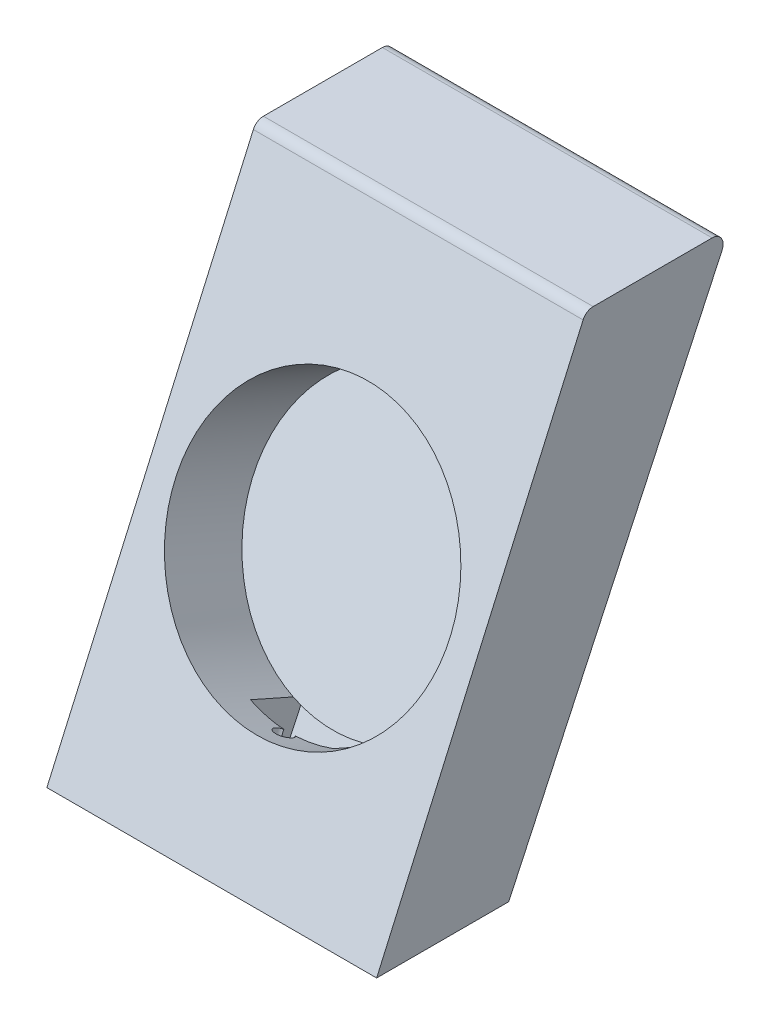
from build123d import *

# Parameters (mm, degrees)
BOSS_EXTRUDE1_DEPTH              = 76.2
FILLET1_R                        = 2.54
CUT_EXTRUDE1_REACH               = 166.479
CUT_EXTRUDE1_OFFSET_FROM_SURFACE = 9
SKETCH2_R                        = 31.75
CUT_EXTRUDE2_REACH               = 157.479
CUT_EXTRUDE2_END_RADIUS          = 31.75
SKETCH6_R                        = 2
CUT_EXTRUDE5_REACH               = 157.479
CUT_EXTRUDE5_END_RADIUS          = 31.75
SKETCH7_W                        = 19.210748655
SKETCH7_H                        = 13.464859675


with BuildPart() as part:
    # Sketch1 → Boss-Extrude1 (new body)
    with BuildSketch(Plane(origin=(0, 0, 0), x_dir=(0, 0, -1), z_dir=(1, 0, 0))):
        Polygon((0, 0), (30.524795297, 0), (81.513688576, 109.346034506), (48.380392686, 109.346034506), align=None)
    extrude(amount=BOSS_EXTRUDE1_DEPTH)

    # Fillet1
    fillet1_edges = [part.edges().sort_by_distance(p)[0] for p in [
        (38.1, 109.346034506, -81.513688576),
        (38.1, 109.346034506, -48.380392686),
    ]]
    fillet(fillet1_edges, radius=FILLET1_R)

    # Cut-Extrude1: up to this face of the body (flat: up to its plane, moved by the offset)
    cut_extrude1_end = Plane(part.part.faces().sort_by_distance((38.1, 52.866292061, -55.176752143))[0]).offset(-CUT_EXTRUDE1_OFFSET_FROM_SURFACE)
    # Sketch2 → Cut-Extrude1 (cut, up to the picked face)
    with BuildSketch(Plane(origin=(0, 0, 0), x_dir=(1, 0, 0), z_dir=(0, 0.4046165331441324, 0.9144864466499344)), mode=Mode.PRIVATE) as cut_extrude1_sk1:
        with Locations((37.912855144, 58.087931451)):
            Circle(SKETCH2_R)
    cut_extrude1_tool1 = split(extrude(cut_extrude1_sk1.sketch, amount=-CUT_EXTRUDE1_REACH, mode=Mode.PRIVATE), bisect_by=cut_extrude1_end, keep=Keep.BOTH, mode=Mode.PRIVATE)
    add(cut_extrude1_tool1.solids().sort_by(Axis((37.912855, 53.120626, -23.503337), (0, -0.4046165331441324, -0.9144864466499344)))[0], mode=Mode.SUBTRACT)

    # Cut-Extrude2: up to this cylinder (the profile starts outside it)
    cut_extrude2_end = Plane(origin=(37.912855144, 50.55181344, -29.309190888), z_dir=(0, 0.40461653314413243, 0.9144864466499344)) * Cylinder(CUT_EXTRUDE2_END_RADIUS, 379.458, mode=Mode.PRIVATE)
    # Sketch6 → Cut-Extrude2 (cut, up to the surface)
    with BuildSketch(Plane(origin=(0, 0, 0), x_dir=(-1, 0, 0), z_dir=(0, -0.9063077870366496, 0.4226182617407003)), mode=Mode.PRIVATE) as cut_extrude2_sk1:
        with Locations((-37.762303556, 6.35)):
            Circle(SKETCH6_R)
    cut_extrude2_tool1 = extrude(cut_extrude2_sk1.sketch, amount=-CUT_EXTRUDE2_REACH, mode=Mode.PRIVATE) - cut_extrude2_end
    add(cut_extrude2_tool1.solids().sort_by_distance((37.762304, -2.683626, -5.755054))[0], mode=Mode.SUBTRACT)

    # Cut-Extrude5: up to this cylinder (the profile starts outside it)
    cut_extrude5_end = Plane(origin=(37.912855144, 47.221487107, -36.836165307), z_dir=(0, 0.40461653314413243, 0.9144864466499344)) * Cylinder(CUT_EXTRUDE5_END_RADIUS, 379.458, mode=Mode.PRIVATE)
    # Sketch7 → Cut-Extrude5 (cut, up to the surface)
    with BuildSketch(Plane(origin=(0, 0, 0), x_dir=(-1, 0, 0), z_dir=(0, -0.9063077870366496, 0.4226182617407003)), mode=Mode.PRIVATE) as cut_extrude5_sk1:
        with Locations((-37.656160961, 14.582429838)):
            Rectangle(SKETCH7_W, SKETCH7_H)
    cut_extrude5_tool1 = extrude(cut_extrude5_sk1.sketch, amount=-CUT_EXTRUDE5_REACH, mode=Mode.PRIVATE) - cut_extrude5_end
    add(cut_extrude5_tool1.solids().sort_by_distance((37.656161, -6.162801, -13.21617))[0], mode=Mode.SUBTRACT)


solid = part.part
